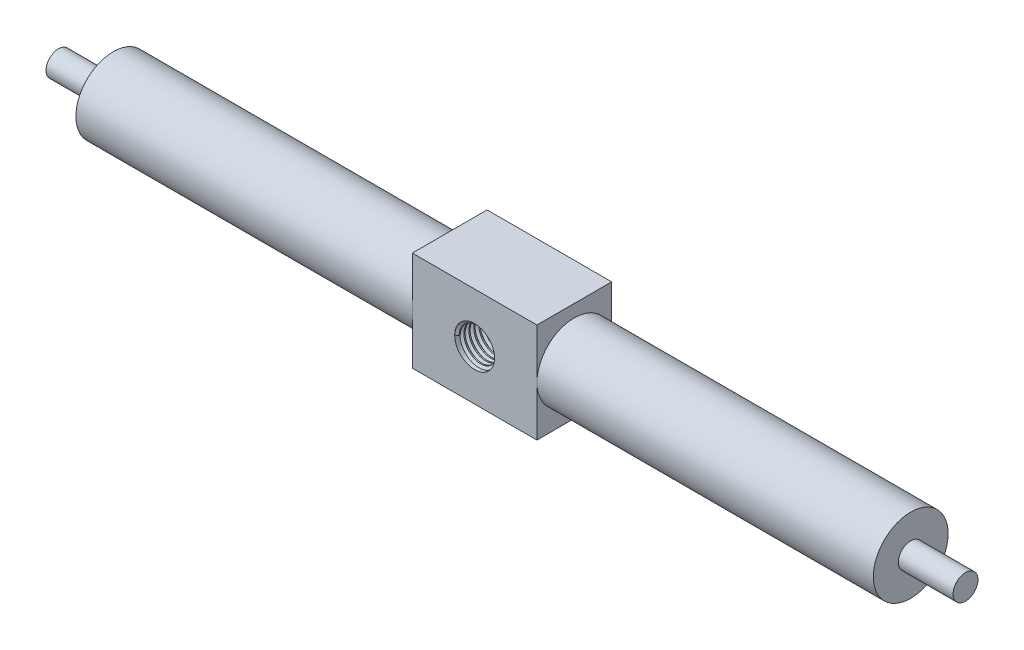
from build123d import *

# Parameters (mm, degrees)
BOSS_EXTRUDE2_DEPTH = 15
SKETCH5_R           = 8.000000000000004
CUT_EXTRUDE2_DEPTH  = 58.00000000000001
THREAD2_PITCH       = 2


with BuildPart() as part:
    # Sketch1 → Revolve2 (revolve)
    with BuildSketch(Plane.XY):
        Polygon((203.6675911859067, 133.43092862624732), (-160.3324088140933, 133.43092862624727), (-160.3324088140933, 138.43092862624738), (-138.3324088140933, 138.43092862624738), (-138.3324088140933, 148.4309286262474), (181.6675911859067, 148.4309286262474), (181.6675911859067, 138.4309286262474), (203.6675911859067, 138.4309286262474), align=None)
    revolve(axis=Axis((203.6675911859067, 133.43092862624732, 0), (-1, -2.3e-16, 0)))

    # Sketch4 → Boss-Extrude2 (add, symmetric)
    with BuildSketch(Plane.XY):
        Polygon((-3.3324088140933132, 153.43092862624727), (46.66759118590669, 153.43092862624727), (46.667591185906694, 113.43092862624728), (-3.332408814093309, 113.43092862624728), align=None)
    extrude(amount=BOSS_EXTRUDE2_DEPTH, both=True)

    # Sketch5 → Cut-Extrude2 (cut)
    with BuildSketch(Plane.XY.offset(15)):
        with Locations((21.667591185906694, 133.4309286262473)):
            Circle(SKETCH5_R)
    extrude(amount=-CUT_EXTRUDE2_DEPTH, mode=Mode.SUBTRACT)

    # Thread2: the profile of Thread Profile2 profile screwed along a right-hand helix of 15 turns, 10 arcs to a turn; built about Z, then put on its axis
    thread2_z = Axis((0, 0, 0), (0, 0, 1))
    thread2_corners = [(8.0003, 0, -0.000173205), (8.0003, 0, 1.7501732), (6.91746825, 0, 1.124999997), (6.91746825, 0, 0.624999997)]
    with BuildLine(mode=Mode.PRIVATE) as thread2_profile:
        Line(thread2_corners[0], thread2_corners[1])
        Line(thread2_corners[1], thread2_corners[2])
        Line(thread2_corners[2], thread2_corners[3])
        Line(thread2_corners[3], thread2_corners[0])
    thread2_cap = Face(thread2_profile.wire())
    thread2_turn_angles = [0, 18, 36, 54, 72, 90, 108, 126, 144, 162, 180, 198, 216, 234, 252, 270, 288, 306, 324, 342, 360]
    thread2_turn_weights = [1, 0.9510565162951535, 1, 0.9510565162951535, 1, 0.9510565162951535, 1, 0.9510565162951535, 1, 0.9510565162951535, 1, 0.9510565162951535, 1, 0.9510565162951535, 1, 0.9510565162951535, 1, 0.9510565162951535, 1, 0.9510565162951535, 1]
    thread2_turn_rails = [Edge.make_bspline([Vector(p[0], p[1], 0).rotate(thread2_z, thread2_turn_angles[k]) / thread2_turn_weights[k] + Vector(0, 0, p[2] + THREAD2_PITCH * thread2_turn_angles[k] / 360) for k in range(21)], [0, 0, 0, 1, 1, 2, 2, 3, 3, 4, 4, 5, 5, 6, 6, 7, 7, 8, 8, 9, 9, 10, 10, 10], 2, thread2_turn_weights) for p in thread2_corners]
    thread2_turn_sides = [Face.make_surface_from_curves(thread2_turn_rails[p[0]], thread2_turn_rails[p[1]]) for p in [(0, 1), (1, 2), (2, 3), (3, 0)]]
    thread2 = Plane(origin=(21.667591186, 133.430928626, 15), x_dir=(-1, 0, 0), z_dir=(0, 0, -1)) * Solid(Shell([*[p.moved(Location((0, 0, THREAD2_PITCH * i))) for i in range(15) for p in thread2_turn_sides], thread2_cap, thread2_cap.rotate(thread2_z, 5400).moved(Location((0, 0, THREAD2_PITCH * 5400 / 360)))]))
    add(thread2)


solid = part.part
